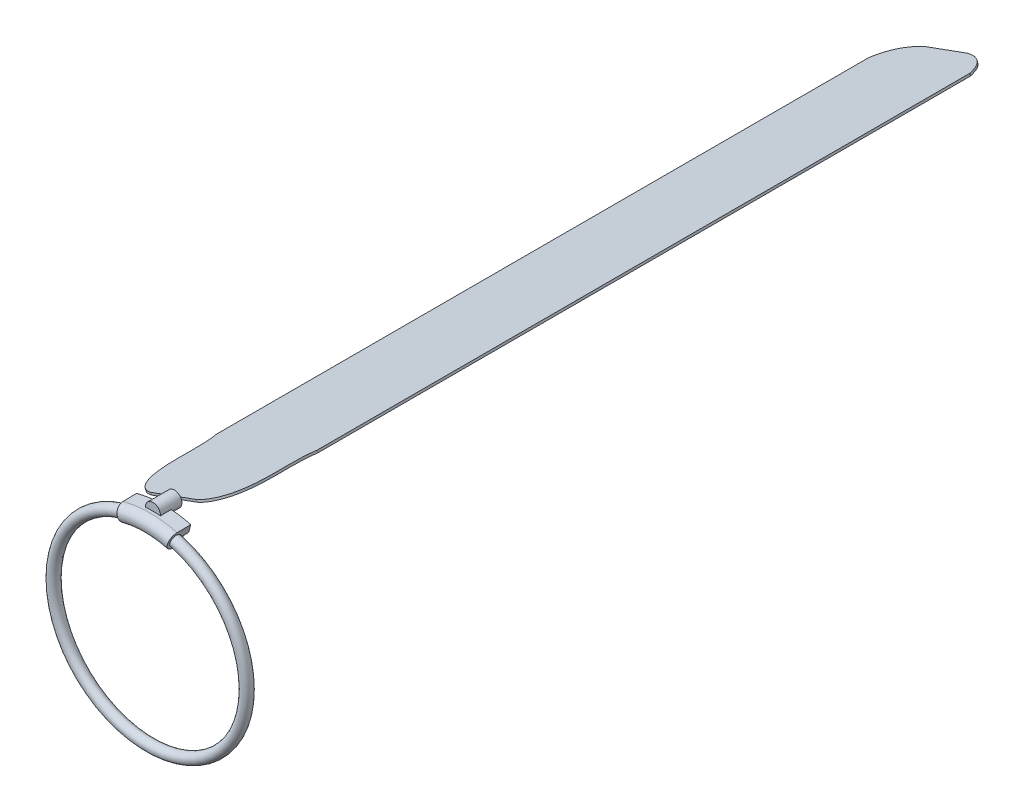
from build123d import *
from build123d.topology import SkipClean

# Parameters (mm, degrees)
REVOLVE_4_ANGLE          = 30
SKETCH_4_R               = 3.5
EXTRUDE_1_DEPTH          = 5
SKETCH_7_W               = 50
SKETCH_7_H               = 360
EXTRUDE_2_DEPTH          = 1
CUT_EXTRUDE_1_DEPTH      = 343.944475712
CUT_EXTRUDE_1_DEPTH_BACK = 343.944475712
CUT_EXTRUDE_2_DEPTH      = 343.944475826
CUT_EXTRUDE_2_DEPTH_BACK = 343.944475826
SKETCH_10_R              = 2.5
SKETCH_13_R              = 2.5


# Read off the part's stored shape, not the designer's step: 旋转4
with BuildPart() as part:
    # 旋转4 outline → 旋转4 (revolve)
    with BuildSketch(Plane(origin=(-4.145535771, 10.115302746, 0), x_dir=(0.2588190451025214, 0.9659258262890681, 0), z_dir=(0.9659258262890681, -0.2588190451025214, 0))):
        with BuildLine():
            Line((48.79373495, 24.584801914), (48.7, 30.884801913))
            ThreePointArc((48.7, 30.884801913), (42.38370491, 33.501097003), (45, 27.184801913))
            Line((45, 27.184801913), (45, 24.584801914))
            Line((45, 24.584801914), (48.79373495, 24.584801914))
        make_face()
    revolve(axis=Axis((-4.145535771, 10.115302746, 0), (0, 0, 1)), revolution_arc=REVOLVE_4_ANGLE)

    # 草图4 → 凸台-拉伸1 (add, symmetric)
    with SkipClean():  # the faces are left unmerged after this step: merging them gives an invalid solid
        with BuildSketch(Plane(origin=(0, 0, 24.584801914), x_dir=(-1, 0, 0), z_dir=(0, 0, -1))):
            with Locations(Location((4.145535771, 58.909037696, 0), (0, 0, 182.055368844))):
                Circle(SKETCH_4_R)
        extrude(amount=EXTRUDE_1_DEPTH, both=True)

    # 草图7 → 凸台-拉伸2 (add)
    with SkipClean():  # the faces are left unmerged after this step: merging them gives an invalid solid
        with BuildSketch(Plane(origin=(-19.41793533, 53.35033885, 0), x_dir=(-0.9396926207859081, -0.34202014332566943, 0), z_dir=(-0.34202014332566943, 0.9396926207859081, 0))):
            with Locations((-16.252548143, -160.415198086)):
                Rectangle(SKETCH_7_W, SKETCH_7_H)
        extrude(amount=EXTRUDE_2_DEPTH)

    # 草图8 → 切除-拉伸1 (cut, two sides: drawn at the far end of the back side and taken through both)
    with SkipClean():  # the faces are left unmerged after this step: merging them gives an invalid solid
        with BuildSketch(Plane(origin=(-19.759955473, 54.290031471, 0), x_dir=(0.9396926207859082, 0.3420201433256695, 0), z_dir=(-0.3420201433256695, 0.9396926207859082, 0)).offset(-CUT_EXTRUDE_1_DEPTH_BACK)):
            with BuildLine():
                Line((41.252548143, -19.584801914), (41.252548143, 23.821846561))
                add(Edge.make_bspline(
                    [(27.504872765, -19.584801914), (31.73786331, -19.07232861), (36.657141019, -14.263450573), (39.412364189, -5.517206126), (40.655209173, 6.65100326), (39.363996158, 17.087656662), (41.252548143, 23.821846561)],
                    knots=[0.037048612, 0.037048612, 0.037048612, 0.037048612, 0.227677085, 0.340409594, 0.466381752, 0.809603539, 0.809603539, 0.809603539, 0.809603539], degree=3))
                Line((27.504872765, -19.584801914), (41.252548143, -19.584801914))
            make_face()
            with BuildLine():
                Line((-8.747451857, -19.584801914), (5.000223521, -19.584801914))
                add(Edge.make_bspline(
                    [(5.000223521, -19.584801914), (0.767232977, -19.07232861), (-4.152044732, -14.263450573), (-6.907267902, -5.517206126), (-8.150112886, 6.65100326), (-6.858899871, 17.087656662), (-8.747451857, 23.821846561)],
                    knots=[0.037048612, 0.037048612, 0.037048612, 0.037048612, 0.227677085, 0.340409594, 0.466381752, 0.809603539, 0.809603539, 0.809603539, 0.809603539], degree=3))
                Line((-8.747451857, 23.821846561), (-8.747451857, -19.584801914))
            make_face()
        extrude(amount=CUT_EXTRUDE_1_DEPTH + CUT_EXTRUDE_1_DEPTH_BACK, mode=Mode.SUBTRACT)

    # 草图9 → 切除-拉伸2 (cut, two sides: drawn at the far end of the back side and taken through both)
    with SkipClean():  # the faces are left unmerged after this step: merging them gives an invalid solid
        with BuildSketch(Plane(origin=(-19.759955473, 54.290031471, 0), x_dir=(0.9396926207859082, 0.3420201433256695, 0), z_dir=(-0.3420201433256695, 0.9396926207859082, 0)).offset(-CUT_EXTRUDE_2_DEPTH_BACK)):
            with BuildLine():
                add(Edge.make_bspline(
                    [(26.083588303, 340.415198086), (31.006568105, 340.211900579), (38.097666372, 336.040393165), (40.500108091, 329.801156179), (41.252548143, 327.888172846)],
                    knots=[0, 0, 0, 0, 0.427766373, 0.590490453, 0.590490453, 0.590490453, 0.590490453], degree=3))
                Line((41.252548143, 327.888172846), (41.252548143, 340.415198086))
                Line((41.252548143, 340.415198086), (26.083588303, 340.415198086))
            make_face()
            with BuildLine():
                add(Edge.make_bspline(
                    [(6.421507983, 340.415198086), (1.498528181, 340.211900579), (-5.592570086, 336.040393165), (-7.995011804, 329.801156179), (-8.747451857, 327.888172846)],
                    knots=[0, 0, 0, 0, 0.427766373, 0.590490453, 0.590490453, 0.590490453, 0.590490453], degree=3))
                Line((6.421507983, 340.415198086), (-8.747451857, 340.415198086))
                Line((-8.747451857, 340.415198086), (-8.747451857, 327.888172846))
            make_face()
        extrude(amount=CUT_EXTRUDE_2_DEPTH + CUT_EXTRUDE_2_DEPTH_BACK, mode=Mode.SUBTRACT)

    # 草图10 → 切除-旋转1 (revolve, cut)
    with SkipClean():  # the faces are left unmerged after this step: merging them gives an invalid solid
        with BuildSketch(Plane(origin=(-6.396663217, 1.713980743, 0), x_dir=(0, 0, -1), z_dir=(0.9659258262890681, -0.25881904510252135, 0)), mode=Mode.PRIVATE) as cut_revolve_1_sk:
            with Locations((-30.884801913, 53.697688553)):
                Circle(SKETCH_10_R)
        revolve(cut_revolve_1_sk.sketch.rotate(Axis((-4.145535771, 10.115302746, 0), (0, 0, 1)), 15), axis=Axis((-4.145535771, 10.115302746, 0), (0, 0, 1)), mode=Mode.SUBTRACT)


with BuildPart() as body_2:
    # 草图13 → 旋转5 (revolve)
    with BuildSketch(Plane(origin=(-6.396663217, 1.713980743, 0), x_dir=(0, 0, -1), z_dir=(0.9659258262890681, -0.25881904510252135, 0)), mode=Mode.PRIVATE) as revolve_5_sk:
        with Locations((-30.884801913, 53.697688553)):
            Circle(SKETCH_13_R)
    revolve(revolve_5_sk.sketch.rotate(Axis((-4.145535771, 10.115302746, 0), (0, 0, 1)), 15), axis=Axis((-4.145535771, 10.115302746, 0), (0, 0, 1)))


solid = Compound([part.part, body_2.part])
